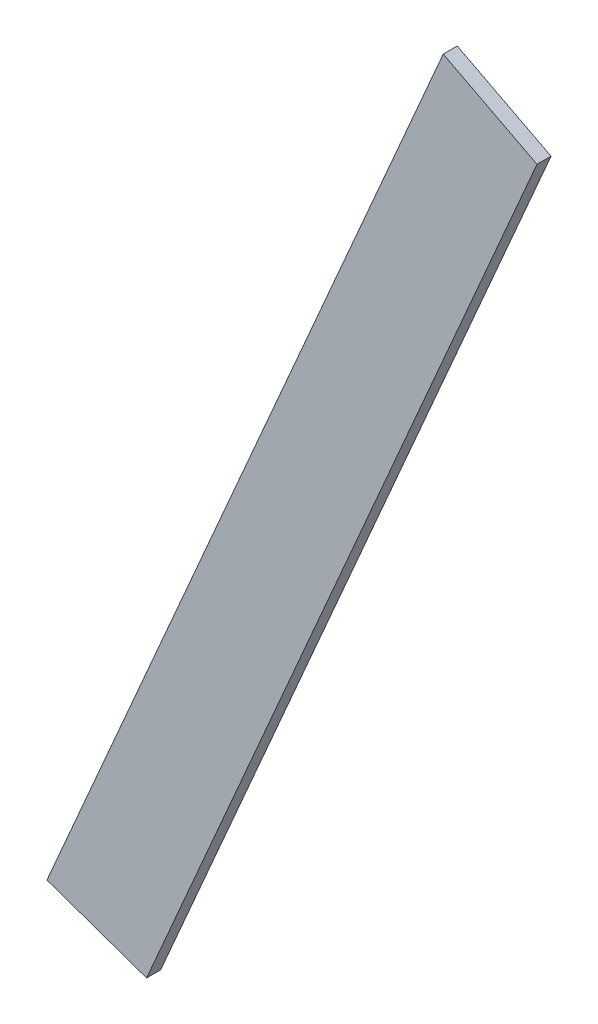
from build123d import *

# Parameters (mm, degrees)
BOSS_EXTRUDE1_DEPTH = 2


with BuildPart() as part:
    # Sketch1 → Boss-Extrude1 (new body)
    with BuildSketch(Plane.XY):
        Polygon((31.618250632, -12.254295737), (17.43228696, -7.264289311), (73.850894362, 122.773706856), (87.201896739, 115.859216671), align=None)
    extrude(amount=BOSS_EXTRUDE1_DEPTH)


solid = part.part
